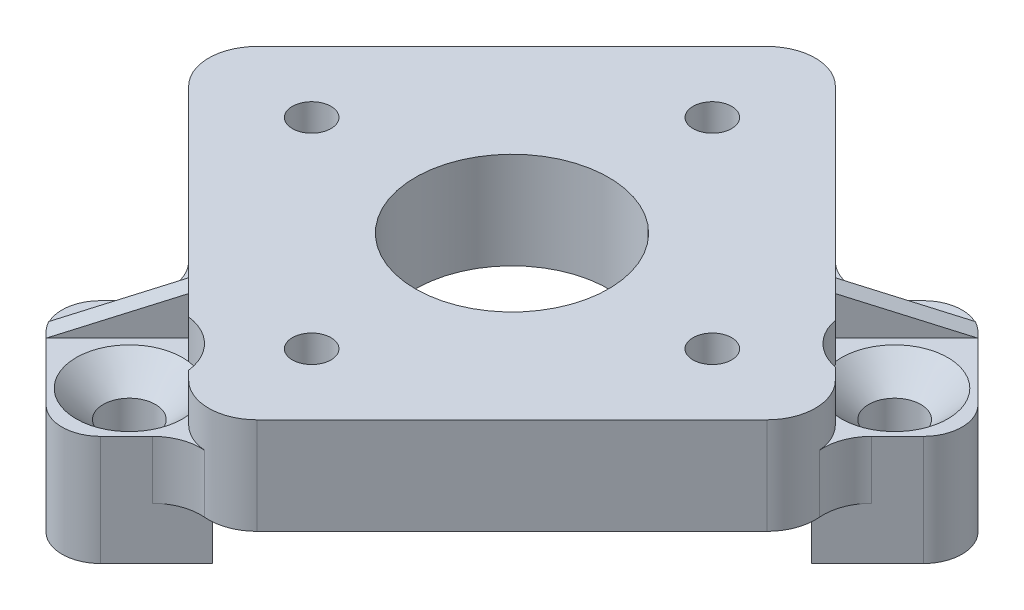
from build123d import *

# Parameters (mm, degrees)
SKETCH1_R                                      = 0.5
SKETCH1_R_2                                    = 5
BOSS_EXTRUDE1_DEPTH                            = 5
SKETCH3_R                                      = 1.3
BOSS_EXTRUDE4_DEPTH                            = 5.7
BOSS_EXTRUDE6_DEPTH                            = 1
FILLET1_R                                      = 2.5
FILLET2_R                                      = 2
F_2_0MM_DOWEL_HOLE1_D                          = 2
F_2_0MM_DOWEL_HOLE1_DEPTH                      = 42.93
F_2_0MM_DOWEL_HOLE1_TIP                        = 0.600860619
SKETCH12_R                                     = 2.75
SKETCH12_R_2                                   = 2.625
CUT_EXTRUDE1_DEPTH                             = 10
CSK_FOR_M2_5_FLAT_HEAD_MACHINE_SCREW1_AT_COUNT = 2
CSK_FOR_M2_5_FLAT_HEAD_MACHINE_SCREW1_AT_PITCH = 28


with BuildPart() as part:
    # Sketch1 → Boss-Extrude1 (new body)
    with BuildSketch(Plane(origin=(0, 0, 0), x_dir=(1, 0, 0), z_dir=(0, 1, 0))):
        with BuildLine():
            Line((1.767766953, 14.961194078), (14.961194078, 1.767766953))
            ThreePointArc((14.961194078, 1.767766953), (15.693427125, 0), (14.961194078, -1.767766953))
            Line((14.961194078, -1.767766953), (1.767766953, -14.961194078))
            ThreePointArc((1.767766953, -14.961194078), (0, -15.693427125), (-1.767766953, -14.961194078))
            Line((-1.767766953, -14.961194078), (-14.961194078, -1.767766953))
            ThreePointArc((-14.961194078, -1.767766953), (-15.693427125, 0), (-14.961194078, 1.767766953))
            Line((-14.961194078, 1.767766953), (-1.767766953, 14.961194078))
            ThreePointArc((-1.767766953, 14.961194078), (0, 15.693427125), (1.767766953, 14.961194078))
        make_face()
        with Locations(Location((0, 10.365, 0), (0, 0, 270))):
            Circle(SKETCH1_R, mode=Mode.SUBTRACT)
        with Locations(Location((0, -10.365, 0), (0, 0, 270))):
            Circle(SKETCH1_R, mode=Mode.SUBTRACT)
        with Locations(Location((10.365, 0, 0), (0, 0, 270))):
            Circle(SKETCH1_R, mode=Mode.SUBTRACT)
        with Locations(Location((-10.365, 0, 0), (0, 0, 270))):
            Circle(SKETCH1_R, mode=Mode.SUBTRACT)
        with Locations(Location((0, 0, 0), (0, 0, 270))):
            Circle(SKETCH1_R_2, mode=Mode.SUBTRACT)
    extrude(amount=BOSS_EXTRUDE1_DEPTH)

    # Sketch3 → Boss-Extrude4 (add)
    # profile 1 of 4: a face of its own
    with BuildSketch(Plane(origin=(0, -2.7, 0), x_dir=(1, 0, 0), z_dir=(0, 1, 0))):
        Polygon((-4.949747468, -10.537489101), (-0.637994164, -14.849242405), (-4.949747468, -19.160995709), (-9.261500772, -14.849242405), align=None)
        with Locations(Location((-4.949747468, -14.849242405, 0), (0, 0, 90))):
            Circle(SKETCH3_R, mode=Mode.SUBTRACT)
    # profile 2 of 4: a face of its own
    with BuildSketch(Plane(origin=(0, -2.7, 0), x_dir=(1, 0, 0), z_dir=(0, 1, 0))):
        Polygon((-6.717514421, -8.769722148), (-11.029267725, -13.081475452), (-9.261500772, -14.849242405), (-4.949747468, -10.537489101), align=None)
    # profile 3 of 4: a face of its own
    with BuildSketch(Plane(origin=(0, -2.7, 0), x_dir=(1, 0, 0), z_dir=(0, 1, 0))):
        Polygon((19.160995709, 4.949747468), (14.849242405, 9.261500772), (10.537489101, 4.949747468), (14.849242405, 0.637994164), align=None)
        with Locations(Location((14.849242405, 4.949747468, 0), (0, 0, 90))):
            Circle(SKETCH3_R, mode=Mode.SUBTRACT)
    # profile 4 of 4: a face of its own
    with BuildSketch(Plane(origin=(0, -2.7, 0), x_dir=(1, 0, 0), z_dir=(0, 1, 0))):
        Polygon((13.081475452, 11.029267725), (14.849242405, 9.261500772), (10.537489101, 4.949747468), (8.769722148, 6.717514421), align=None)
    extrude(amount=BOSS_EXTRUDE4_DEPTH)


with BuildPart() as boss_extrude6_tool:
    # Sketch7 → Boss-Extrude6 (new body)
    with BuildSketch(Plane(origin=(2.707626069, -2.13e-07, 2.707626069), x_dir=(0.7071067811865474, 0, -0.7071067811865478), z_dir=(0.7071067811865467, -5.5755039757469385e-08, 0.7071067811865462))):
        Polygon((11.829161787, 5.00000052), (17.04887, 3.00000056), (11.829161787, 3.00000052), align=None)
        Polygon((-11.829161787, 5.00000052), (-17.04887, 3.00000056), (-11.829161787, 3.00000052), align=None)
    extrude(amount=-BOSS_EXTRUDE6_DEPTH)


with BuildPart() as part_1:
    add(part.part)


with BuildPart() as part_2:
    # Boss-Extrude6: joined with boss_extrude6_tool
    add(part_1.part.fuse(boss_extrude6_tool.part, tol=0.00001))

    # Fillet1
    fillet1_edges = [part_2.edges().sort_by_distance(p)[0] for p in [
        (-7.338376652, 1.5, 9.390584379),
        (-1.184018869, 1.5, 15.395267109),
        (9.390584379, 1.5, -7.338376652),
        (15.395267109, 1.5, -1.184018869),
    ]]
    fillet(fillet1_edges, radius=FILLET1_R)

    # Fillet2
    # the kernel refuses this fillet: 2 mm, written as the material it takes off along each edge
    with BuildSketch(Plane(origin=(-4.949747468, -7.7, 19.160995709), x_dir=(-0.7071067811865471, 0, -0.707106781186548), z_dir=(0, 1, 0)), Plane(origin=(13.081475452, -7.7, -11.029267725), x_dir=(0.7071067811865476, 0, 0.7071067811865476), z_dir=(0, 1, 0))) as fillet2_piece_1:
        with BuildLine():
            CenterArc((FILLET2_R, -FILLET2_R), FILLET2_R, 90, 90)
            Line((0, -FILLET2_R), (0, 0))
            Line((0, 0), (FILLET2_R, 0))
        make_face()
    extrude(amount=15.7, mode=Mode.SUBTRACT)
    with BuildSketch(Plane(origin=(-11.029267725, -7.7, 13.081475452), x_dir=(0.707106781186547, 0, 0.7071067811865479), z_dir=(0, 1, 0)), Plane(origin=(19.160995709, -7.7, -4.949747468), x_dir=(-0.7071067811865482, 0, -0.7071067811865469), z_dir=(0, 1, 0))) as fillet2_piece_2:
        with BuildLine():
            CenterArc((FILLET2_R, FILLET2_R), FILLET2_R, 180, 90)
            Line((0, FILLET2_R), (0, 0))
            Line((0, 0), (FILLET2_R, 0))
        make_face()
    extrude(amount=15.7, mode=Mode.SUBTRACT)

    # Ø2.0mm Dowel Hole1
    with Locations(Plane.XZ):
        with Locations((0, 10.365), (10.365, 0), (-10.365, 0), (0, -10.365)):
            Hole(F_2_0MM_DOWEL_HOLE1_D / 2, depth=F_2_0MM_DOWEL_HOLE1_DEPTH)
            with Locations((0, 0, -(F_2_0MM_DOWEL_HOLE1_DEPTH + F_2_0MM_DOWEL_HOLE1_TIP / 2))):  # 118° drill point
                Cone(0, F_2_0MM_DOWEL_HOLE1_D / 2, F_2_0MM_DOWEL_HOLE1_TIP, mode=Mode.SUBTRACT)

    # Sketch12 → Cut-Extrude1 (cut)
    with BuildSketch(Plane(origin=(0, 3, 0), x_dir=(1, 0, 0), z_dir=(0, 1, 0))):
        with Locations((-4.949747468, -14.849242405)):
            Circle(SKETCH12_R)
        with Locations((14.849242405, 4.949747468)):
            Circle(SKETCH12_R_2)
    extrude(amount=CUT_EXTRUDE1_DEPTH, mode=Mode.SUBTRACT)

    # Sketch13 → CSK for M2.5 Flat Head Machine Screw1 (revolve, cut)
    with BuildSketch(Plane(origin=(-4.949747468, 3, 14.849242405), x_dir=(0, 0, 1), z_dir=(1, 0, 0))):
        Polygon((0, 0), (0, 43.741161836), (1.35, 42.93), (1.35, 1.4), (2.75, 0), align=None)
    csk_for_m2_5_flat_head_machine_screw1 = revolve(axis=Axis((-4.949747468, 9.35, 14.849242405), (0, -1, 0)), mode=Mode.SUBTRACT)

    # CSK for M2.5 Flat Head Machine Screw1 at: CSK for M2.5 Flat Head Machine Screw1 ×2
    with Locations(*[Vector(0.7071067811865477, 0, -0.7071067811865475) * (i * CSK_FOR_M2_5_FLAT_HEAD_MACHINE_SCREW1_AT_PITCH) for i in range(1, CSK_FOR_M2_5_FLAT_HEAD_MACHINE_SCREW1_AT_COUNT)]):
        add(csk_for_m2_5_flat_head_machine_screw1, mode=Mode.SUBTRACT)


solid = part_2.part
